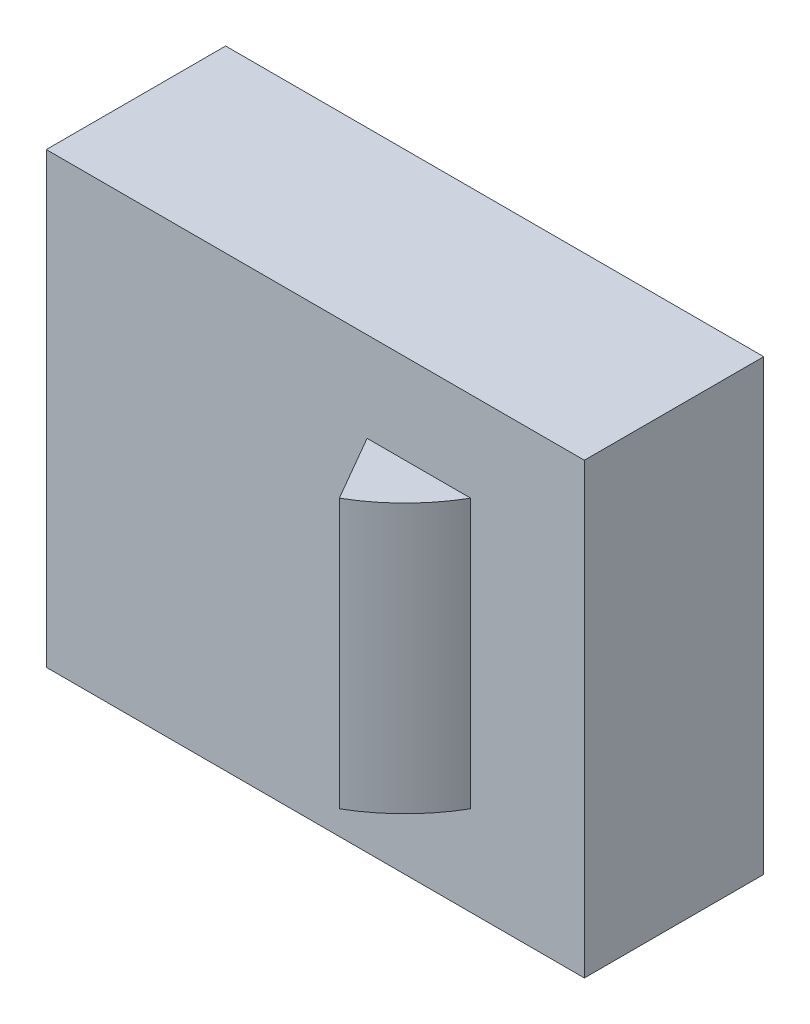
from build123d import *

# Parameters (mm, degrees)
SKETCH1_W           = 60
SKETCH1_H           = 50
BOSS_EXTRUDE1_DEPTH = 10
REVOLVE1_DEPTH      = 30


# Read off the part's stored shape, not the designer's step: Revolve1
with BuildPart() as part:
    # Sketch1 → Boss-Extrude1 (new, symmetric)
    with BuildSketch(Plane.XY):
        with Locations((0, 15)):
            Rectangle(SKETCH1_W, SKETCH1_H)
    extrude(amount=BOSS_EXTRUDE1_DEPTH, both=True)

    # Revolve1 outline → Revolve1 (add)
    with BuildSketch(Plane(origin=(0, 0, 0), x_dir=(1, 0, 0), z_dir=(0, 1, 0))):
        with BuildLine():
            Line((10, 17.320508076), (5.773502692, 10))
            Line((5.773502692, 10), (17.320508076, 10))
            ThreePointArc((17.320508076, 10), (14.142135624, 14.142135624), (10, 17.320508076))
        make_face()
        with BuildLine():
            ThreePointArc((10, -17.320508076), (14.142135624, -14.142135624), (17.320508076, -10))
            Line((17.320508076, -10), (5.773502692, -10))
            Line((5.773502692, -10), (10, -17.320508076))
        make_face()
    extrude(amount=REVOLVE1_DEPTH)


solid = part.part
